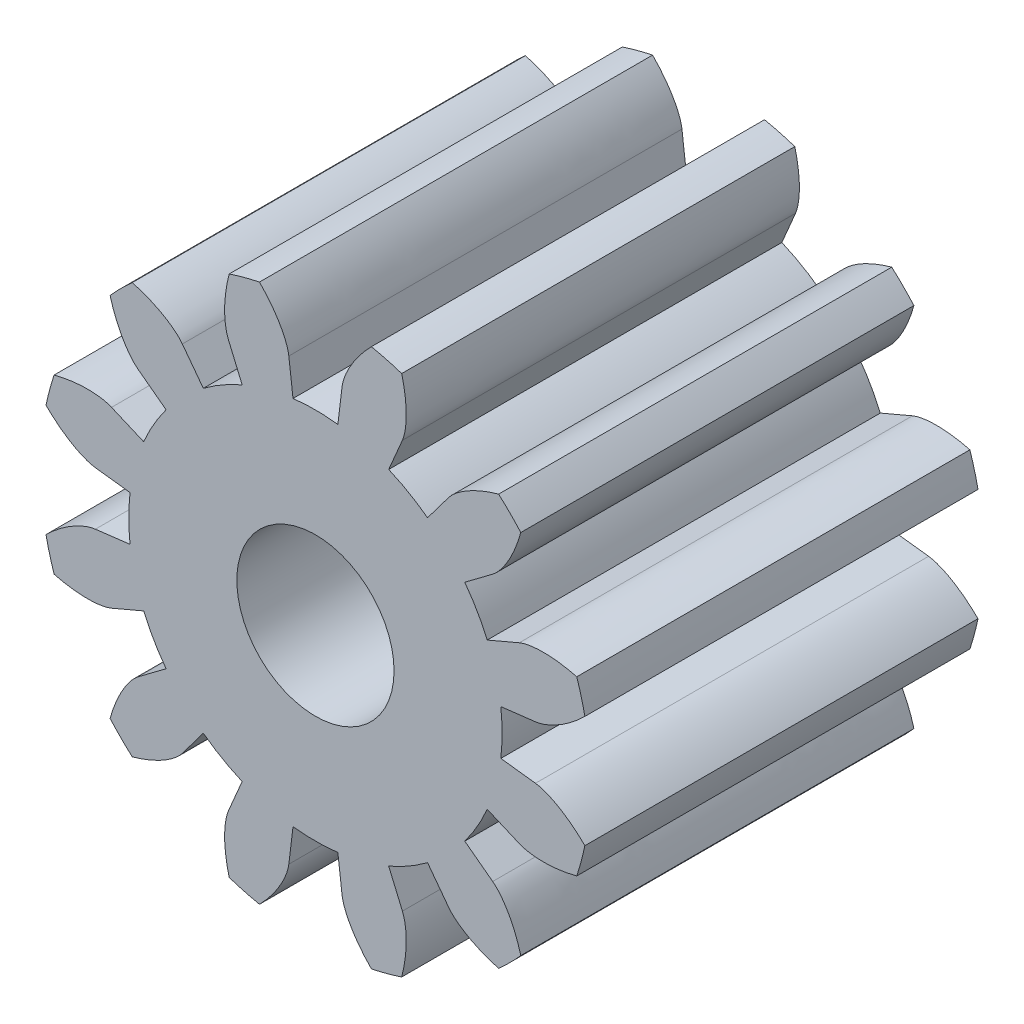
from build123d import *

# Parameters (mm, degrees)
SKETCH_1_R               = 3.5
SKETCH_1_R_2             = 1
EXTRUDE_1_DEPTH          = 5
CUT_EXTRUDE_1_DEPTH      = 8.03562364
PATTERN_CIRCULAR_1_COUNT = 12
PATTERN_CIRCULAR_1_ANGLE = 330


with BuildPart() as part:
    # 草图1 → 凸台-拉伸1 (new body)
    with BuildSketch(Plane.XY):
        Circle(SKETCH_1_R)
        Circle(SKETCH_1_R_2, mode=Mode.SUBTRACT)
    extrude(amount=EXTRUDE_1_DEPTH)

    # 草图1<3> → 切除-拉伸1 (cut, through all)
    with BuildSketch(Plane.XY):
        with BuildLine():
            Line((2.798674517, 0.338557149), (2.35781071, 0.285225619))
            ThreePointArc((2.35781071, 0.285225619), (2.370698783, 0.142871556), (2.375, 0))
            ThreePointArc((2.375, 0), (2.370698783, -0.142871556), (2.35781071, -0.285225619))
            Line((2.35781071, -0.285225619), (2.798674517, -0.338557149))
            add(Edge.make_bspline(
                [(2.798674517, -0.338557149), (2.820008056, -0.341137879), (2.879006464, -0.352773723), (2.987300435, -0.392418534), (3.151365451, -0.479633034), (3.283118458, -0.578442717), (3.376429222, -0.662188381), (3.426855282, -0.711802555)],
                knots=[0, 0, 0, 0, 0, 0.005604068, 0.015718248, 0.029959916, 0.048452597, 0.048452597, 0.048452597, 0.048452597, 0.048452597], degree=4))
            ThreePointArc((3.426855282, -0.711802555), (3.4816658, -0.357775428), (3.5, 0))
            ThreePointArc((3.5, 0), (3.4816658, 0.357775428), (3.426855282, 0.711802555))
            add(Edge.make_bspline(
                [(2.798674517, 0.338557149), (2.820008056, 0.341137879), (2.879006464, 0.352773723), (2.987300435, 0.392418534), (3.151365451, 0.479633034), (3.283118458, 0.578442717), (3.376429222, 0.662188381), (3.426855282, 0.711802555)],
                knots=[0, 0, 0, 0, 0, 0.005604068, 0.015718248, 0.029959916, 0.048452597, 0.048452597, 0.048452597, 0.048452597, 0.048452597], degree=4))
        make_face()
    cut_extrude_1 = extrude(amount=CUT_EXTRUDE_1_DEPTH, mode=Mode.SUBTRACT)

    # 阵列(圆周)1: 切除-拉伸1 ×12 about axis
    pattern_circular_1_axis = Axis((0, 0, 5), (0, 0, 1))
    for i in range(1, PATTERN_CIRCULAR_1_COUNT):
        add(cut_extrude_1.rotate(pattern_circular_1_axis, i * PATTERN_CIRCULAR_1_ANGLE / (PATTERN_CIRCULAR_1_COUNT - 1)), mode=Mode.SUBTRACT)


solid = part.part
